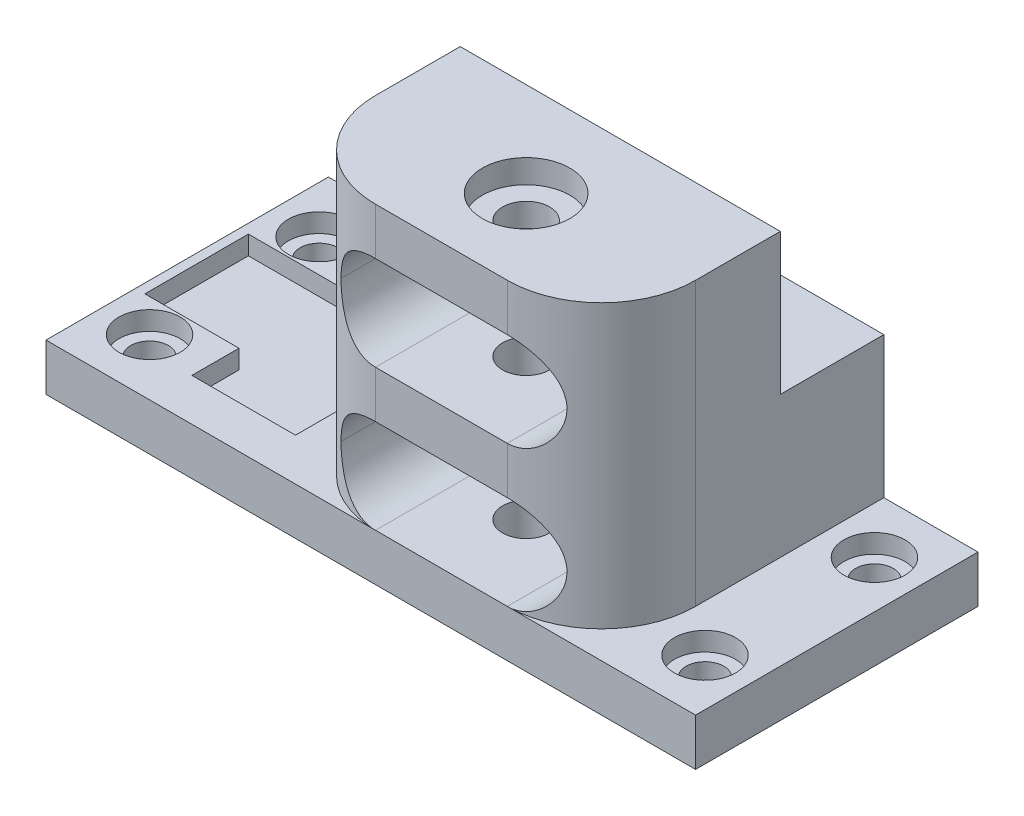
from build123d import *

# Parameters (mm, degrees)
CROQUIS21_W             = 34
CROQUIS21_H             = 30
SALIENTE_EXTRUIR4_DEPTH = 17.5
CORTAR_EXTRUIR17_REACH  = 63.934
CROQUIS22_W             = 24
CROQUIS22_H             = 10
CORTAR_EXTRUIR18_REACH  = 50.603
CROQUIS23_W             = 11
CROQUIS23_H             = 15
CORTAR_EXTRUIR19_REACH  = 70.953
CROQUIS24_R             = 2.5
CROQUIS25_R             = 4.65
CORTAR_EXTRUIR20_DEPTH  = 2.5
REDONDEO2_R             = 10
REDONDEO3_R             = 5
CROQUIS27_R             = 2
SALIENTE_EXTRUIR5_DEPTH = 5
CROQUIS30_R             = 3.25
CORTAR_EXTRUIR21_DEPTH  = 2


# Some blends are built 0.0001 mm under size
with BuildPart() as part:
    # Croquis21 → Saliente-Extruir4 (new, symmetric)
    with BuildSketch(Plane(origin=(0, 0, 0), x_dir=(1, 0, 0), z_dir=(0, 1, 0))):
        with Locations((34.278993672, -15)):
            Rectangle(CROQUIS21_W, CROQUIS21_H)
    extrude(amount=SALIENTE_EXTRUIR4_DEPTH, both=True)

    # Croquis22 → Cortar-Extruir17 (cut, up to next)
    with BuildSketch(Plane.XY.offset(30), mode=Mode.PRIVATE) as cortar_extruir17_sk1:
        with Locations((34.278993672, 7.5)):
            Rectangle(CROQUIS22_W, CROQUIS22_H)
    cortar_extruir17_tool1 = extrude(cortar_extruir17_sk1.sketch, amount=-CORTAR_EXTRUIR17_REACH, mode=Mode.PRIVATE) & part.part
    # Croquis22 → Cortar-Extruir17 (cut, up to next)
    with BuildSketch(Plane.XY.offset(30), mode=Mode.PRIVATE) as cortar_extruir17_sk2:
        with Locations((34.278993672, -7.5)):
            Rectangle(CROQUIS22_W, CROQUIS22_H)
    cortar_extruir17_tool2 = extrude(cortar_extruir17_sk2.sketch, amount=-CORTAR_EXTRUIR17_REACH, mode=Mode.PRIVATE) & part.part
    add(cortar_extruir17_tool1.solids().sort_by_distance((34.278994, 7.5, 30))[0], mode=Mode.SUBTRACT)
    add(cortar_extruir17_tool2.solids().sort_by_distance((34.278994, -7.5, 30))[0], mode=Mode.SUBTRACT)

    # Croquis23 → Cortar-Extruir18 (cut, up to next)
    with BuildSketch(Plane.ZY.offset(-17.278993672), mode=Mode.PRIVATE) as cortar_extruir18_sk1:
        with Locations((5.5, 10)):
            Rectangle(CROQUIS23_W, CROQUIS23_H)
    cortar_extruir18_tool1 = extrude(cortar_extruir18_sk1.sketch, amount=-CORTAR_EXTRUIR18_REACH, mode=Mode.PRIVATE) & part.part
    add(cortar_extruir18_tool1.solids().sort_by_distance((17.278994, 10, 5.5))[0], mode=Mode.SUBTRACT)

    # Cortar-Extruir19: up to this face of the body (flat: up to its plane)
    cortar_extruir19_end = Plane(part.part.faces().sort_by_distance((34.278993672, -17.5, 15))[0])
    # Croquis24 → Cortar-Extruir19 (cut, up to the picked face)
    with BuildSketch(Plane(origin=(0, 17.5, 0), x_dir=(1, 0, 0), z_dir=(0, 1, 0)), mode=Mode.PRIVATE) as cortar_extruir19_sk1:
        with Locations(Location((34.278993672, -21, 0), (0, 0, 270))):
            Circle(CROQUIS24_R)
    cortar_extruir19_tool1 = split(extrude(cortar_extruir19_sk1.sketch, amount=-CORTAR_EXTRUIR19_REACH, mode=Mode.PRIVATE), bisect_by=cortar_extruir19_end, keep=Keep.BOTH, mode=Mode.PRIVATE)
    add(cortar_extruir19_tool1.solids().sort_by(Axis((34.278994, 17.5, 21), (0, -1, 0)))[0], mode=Mode.SUBTRACT)

    # Croquis25 → Cortar-Extruir20 (cut)
    with BuildSketch(Plane(origin=(0, 17.5, 0), x_dir=(1, 0, 0), z_dir=(0, 1, 0))):
        with Locations(Location((34.278993672, -21, 0), (0, 0, 270))):
            Circle(CROQUIS25_R)
    extrude(amount=-CORTAR_EXTRUIR20_DEPTH, mode=Mode.SUBTRACT)

    # Redondeo2
    # the kernel refuses this fillet: 10 mm, written as the material it takes off along each edge
    with BuildSketch(Plane(origin=(51.278993672, 42.5, 30), x_dir=(0, 0, -1), z_dir=(0, -1, 0)), Plane(origin=(17.278993672, -42.5, 30), x_dir=(0, 0, -1), z_dir=(0, 1, 0))) as redondeo2_piece_1:
        with BuildLine():
            CenterArc((REDONDEO2_R, -REDONDEO2_R), REDONDEO2_R, 90, 90)
            Line((0, -REDONDEO2_R), (0, 0))
            Line((0, 0), (REDONDEO2_R, 0))
        make_face()
    extrude(amount=85, mode=Mode.SUBTRACT)

    # Redondeo3
    redondeo3_edges = [part.edges().sort_by_distance(p)[0] for p in [
        (46.278993672, 12.5, 19.830127019),
        (46.278993672, 2.5, 19.830127019),
        (46.278993672, -12.5, 14.330127019),
        (22.278993672, -12.5, 14.330127019),
        (22.278993672, -2.5, 14.330127019),
        (22.278993672, 12.5, 19.830127019),
        (22.278993672, 2.5, 19.830127019),
        (46.278993672, -2.5, 14.330127019),
    ]]
    fillet(redondeo3_edges, radius=REDONDEO3_R - 0.0001)  # a hair under: the kernel refuses the full size

    # Croquis27 → Saliente-Extruir5 (add)
    # profile 1 of 2: a face of its own
    with BuildSketch(Plane(origin=(0, -12.5, 0), x_dir=(1, 0, 0), z_dir=(0, 1, 0))):
        with BuildLine():
            Line((27.278993672, -30), (17.278993672, -30))
            Line((17.278993672, -30), (-7.721006328, -30))
            Line((-7.721006328, -30), (-7.721006328, 0))
            Line((-7.721006328, 0), (17.278993672, 0))
            Line((17.278993672, 0), (17.278993672, -20))
            ThreePointArc((17.278993672, -20), (20.20792586, -27.071067812), (27.278993672, -30))
        make_face()
        with Locations(Location((-2.721006328, -6, 0), (0, 0, 270))):
            Circle(CROQUIS27_R, mode=Mode.SUBTRACT)
        with Locations(Location((-2.721006328, -24, 0), (0, 0, 90))):
            Circle(CROQUIS27_R, mode=Mode.SUBTRACT)
    # profile 2 of 2: a face of its own
    with BuildSketch(Plane(origin=(0, -12.5, 0), x_dir=(1, 0, 0), z_dir=(0, 1, 0))):
        with BuildLine():
            Line((51.278993672, 0), (51.278993672, -20))
            ThreePointArc((51.278993672, -20), (48.350061484, -27.071067812), (41.278993672, -30))
            Line((41.278993672, -30), (61.278993672, -30))
            Line((61.278993672, -30), (61.278993672, 0))
            Line((61.278993672, 0), (51.278993672, 0))
        make_face()
        with Locations(Location((56.278993672, -6, 0), (0, 0, 90))):
            Circle(CROQUIS27_R, mode=Mode.SUBTRACT)
        with Locations(Location((56.278993672, -24, 0), (0, 0, 270))):
            Circle(CROQUIS27_R, mode=Mode.SUBTRACT)
    extrude(amount=-SALIENTE_EXTRUIR5_DEPTH)

    # Croquis30 → Cortar-Extruir21 (cut)
    with BuildSketch(Plane(origin=(0, -12.5, 0), x_dir=(1, 0, 0), z_dir=(0, 1, 0))):
        with Locations(Location((-2.721006328, -6, 0), (0, 0, 270))):
            Circle(CROQUIS30_R)
        with Locations(Location((-2.721006328, -24, 0), (0, 0, 90))):
            Circle(CROQUIS30_R)
        with Locations(Location((56.278993672, -6, 0), (0, 0, 90))):
            Circle(CROQUIS30_R)
        with Locations(Location((56.278993672, -24, 0), (0, 0, 270))):
            Circle(CROQUIS30_R)
        Polygon((3.278993672, -4.5), (14.278993672, -4.5), (14.278993672, -9.5), (14.278993672, -20.5), (14.278993672, -25.5), (3.278993672, -25.5), (3.278993672, -20.5), (-6.721006328, -20.5), (-6.721006328, -9.5), (3.278993672, -9.5), align=None)
    extrude(amount=-CORTAR_EXTRUIR21_DEPTH, mode=Mode.SUBTRACT)


solid = part.part
